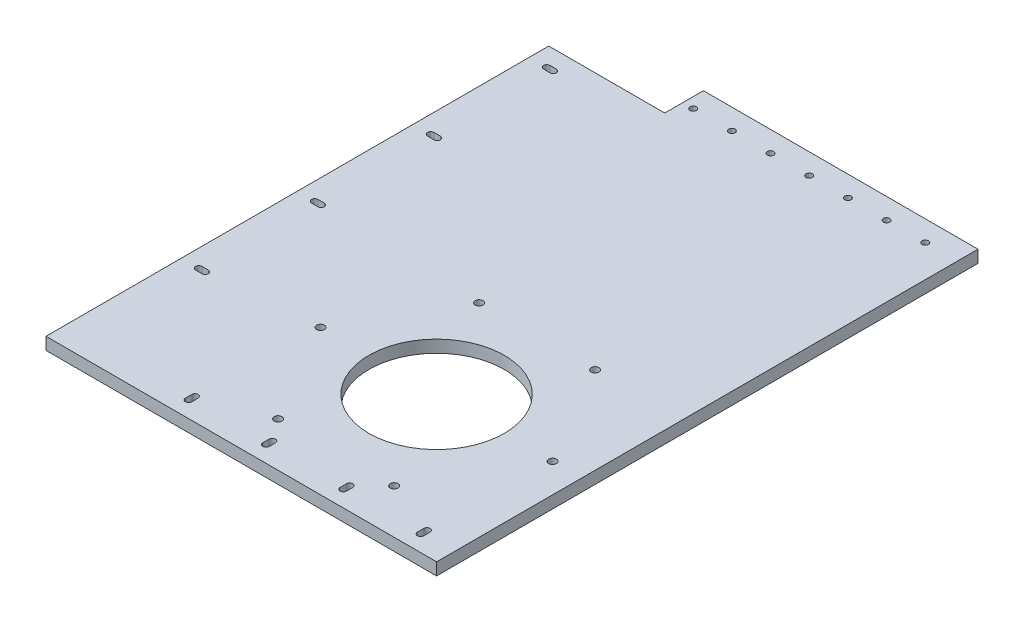
from build123d import *

# Parameters (mm, degrees)
BOSS_EXTRUDE1_DEPTH = 6.35
SKETCH9_R           = 1.65
CUT_EXTRUDE10_DEPTH = 30
CUT_EXTRUDE12_DEPTH = 30
CUT_EXTRUDE13_DEPTH = 10
SKETCH12_R          = 35
CUT_EXTRUDE14_DEPTH = 192.836707905
SKETCH13_R          = 2
CUT_EXTRUDE15_DEPTH = 192.836707905


with BuildPart() as part:
    # Sketch1 → Boss-Extrude1 (new body)
    with BuildSketch(Plane(origin=(0, 0, 0), x_dir=(1, 0, 0), z_dir=(0, 1, 0))):
        Polygon((-71, 140), (71, 140), (71, -140), (-131, -140), (-131, 120), (-71, 120), align=None)
    extrude(amount=BOSS_EXTRUDE1_DEPTH)

    # Sketch9 → Cut-Extrude10 (cut)
    with BuildSketch(Plane(origin=(0, 0, 0), x_dir=(-1, 0, 0), z_dir=(0, -1, 0))):
        with Locations((45.6, 129.325)):
            Circle(SKETCH9_R)
        with Locations((5.6, 129.325)):
            Circle(SKETCH9_R)
        with Locations((-34.4, 129.325)):
            Circle(SKETCH9_R)
        with Locations((65.6, 129.325)):
            Circle(SKETCH9_R)
        with Locations((25.6, 129.325)):
            Circle(SKETCH9_R)
        with Locations((-14.4, 129.325)):
            Circle(SKETCH9_R)
        with Locations((-54.4, 129.325)):
            Circle(SKETCH9_R)
    extrude(amount=-CUT_EXTRUDE10_DEPTH, mode=Mode.SUBTRACT)

    # Sketch11 → Cut-Extrude12 (cut)
    with BuildSketch(Plane(origin=(0, 6.35, 0), x_dir=(1, 0, 0), z_dir=(0, 1, 0))):
        with BuildLine():
            Line((-63.95, -128.355), (-63.95, -131.655))
            ThreePointArc((-63.95, -131.655), (-65.6, -133.305), (-67.25, -131.655))
            Line((-67.25, -131.655), (-67.25, -128.355))
            ThreePointArc((-67.25, -128.355), (-65.6, -126.705), (-63.95, -128.355))
        make_face()
        with BuildLine():
            Line((-23.95, -128.353535871), (-23.95, -131.653535871))
            ThreePointArc((-23.95, -131.653535871), (-25.6, -133.303535871), (-27.25, -131.653535871))
            Line((-27.25, -131.653535871), (-27.25, -128.353535871))
            ThreePointArc((-27.25, -128.353535871), (-25.6, -126.703535871), (-23.95, -128.353535871))
        make_face()
        with BuildLine():
            Line((16.05, -128.352071742), (16.05, -131.652071742))
            ThreePointArc((16.05, -131.652071742), (14.4, -133.302071742), (12.75, -131.652071742))
            Line((12.75, -131.652071742), (12.75, -128.352071742))
            ThreePointArc((12.75, -128.352071742), (14.4, -126.702071742), (16.05, -128.352071742))
        make_face()
        with BuildLine():
            Line((56.05, -128.350607613), (56.05, -131.650607613))
            ThreePointArc((56.05, -131.650607613), (54.4, -133.300607613), (52.75, -131.650607613))
            Line((52.75, -131.650607613), (52.75, -128.350607613))
            ThreePointArc((52.75, -128.350607613), (54.4, -126.700607613), (56.05, -128.350607613))
        make_face()
    extrude(amount=-CUT_EXTRUDE12_DEPTH, mode=Mode.SUBTRACT)

    # Sketch10 → Cut-Extrude13 (cut)
    with BuildSketch(Plane.XZ):
        with BuildLine():
            ThreePointArc((-121.975, 11.65), (-123.625, 10), (-121.975, 8.35))
            Line((-121.975, 8.35), (-118.675, 8.35))
            ThreePointArc((-118.675, 8.35), (-117.025, 10), (-118.675, 11.65))
            Line((-118.675, 11.65), (-121.975, 11.65))
        make_face()
        with BuildLine():
            ThreePointArc((-121.975, 71.65), (-123.625, 70), (-121.975, 68.35))
            Line((-121.975, 68.35), (-118.675, 68.35))
            ThreePointArc((-118.675, 68.35), (-117.025, 70), (-118.675, 71.65))
            Line((-118.675, 71.65), (-121.975, 71.65))
        make_face()
        with BuildLine():
            ThreePointArc((-121.975, -48.35), (-123.625, -50), (-121.975, -51.65))
            Line((-121.975, -51.65), (-118.675, -51.65))
            ThreePointArc((-118.675, -51.65), (-117.025, -50), (-118.675, -48.35))
            Line((-118.675, -48.35), (-121.975, -48.35))
        make_face()
        with BuildLine():
            ThreePointArc((-121.975, -108.35), (-123.625, -110), (-121.975, -111.65))
            Line((-121.975, -111.65), (-118.675, -111.65))
            ThreePointArc((-118.675, -111.65), (-117.025, -110), (-118.675, -108.35))
            Line((-118.675, -108.35), (-121.975, -108.35))
        make_face()
    extrude(amount=-CUT_EXTRUDE13_DEPTH, mode=Mode.SUBTRACT)

    # Sketch12 → Cut-Extrude14 (cut, through all)
    with BuildSketch(Plane(origin=(0, 6.35, 0), x_dir=(1, 0, 0), z_dir=(0, 1, 0))):
        with Locations((-4, -65)):
            Circle(SKETCH12_R)
    extrude(amount=-CUT_EXTRUDE14_DEPTH, mode=Mode.SUBTRACT)

    # Sketch13 → Cut-Extrude15 (cut, through all)
    with BuildSketch(Plane(origin=(0, 6.35, 0), x_dir=(1, 0, 0), z_dir=(0, 1, 0))):
        with Locations((-64, -65)):
            Circle(SKETCH13_R)
        with Locations((-34, -13.038475773)):
            Circle(SKETCH13_R)
        with Locations((26, -13.038475773)):
            Circle(SKETCH13_R)
        with Locations((56, -65)):
            Circle(SKETCH13_R)
        with Locations((26, -116.961524227)):
            Circle(SKETCH13_R)
        with Locations((-34, -116.961524227)):
            Circle(SKETCH13_R)
    extrude(amount=-CUT_EXTRUDE15_DEPTH, mode=Mode.SUBTRACT)


solid = part.part
